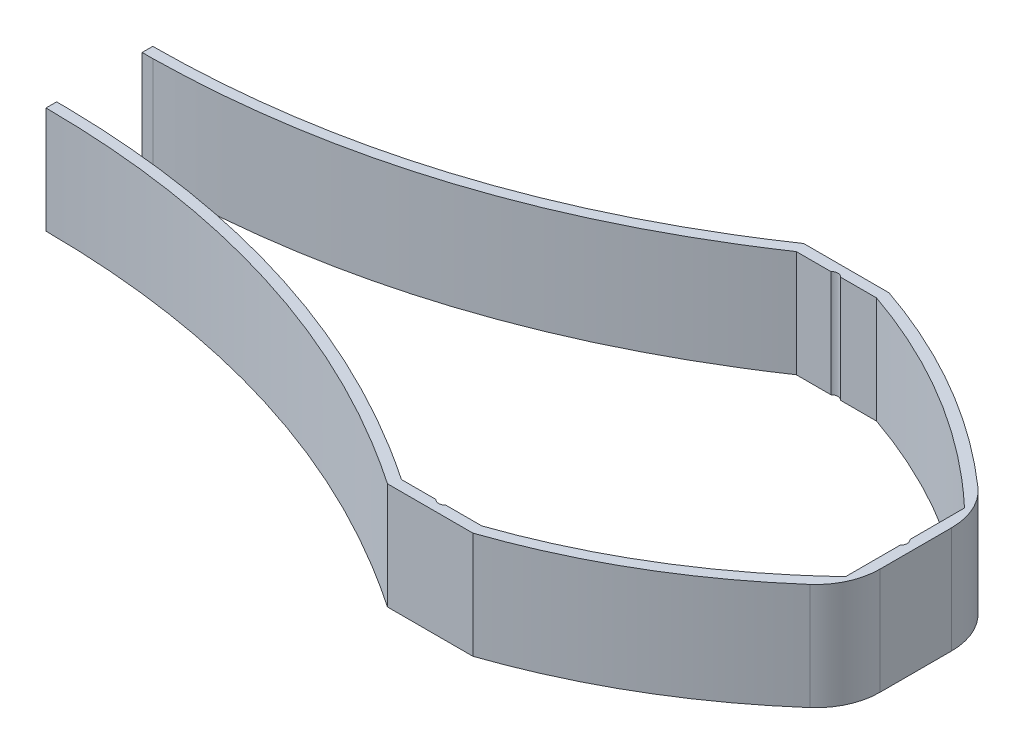
from build123d import *
from build123d.topology import SkipClean

# Parameters (mm, degrees)
BOSS_EXTRUDE1_DEPTH    = 12.5
SKETCH2_R              = 1.5
CUT_EXTRUDE1_DEPTH     = 86.009190843
FILLET1_R              = 15
FILLET1_OF_MIRROR2_R   = 15
BOSS_EXTRUDE2_DEPTH    = 12.5
CUT_EXTRUDE2_START     = -25
CUT_EXTRUDE2_OUTLINE_R = 1.5
CUT_EXTRUDE2_DEPTH     = 25


# Read off the part's stored shape, not the designer's step: Cut-Extrude2
with BuildPart() as part:
    # Sketch1 → Boss-Extrude1 (new, symmetric)
    with BuildSketch(Plane(origin=(0, 0, 0), x_dir=(1, 0, 0), z_dir=(0, 1, 0))):
        with BuildLine():
            Line((0, 0), (0, 48.75))
            Line((0, 48.75), (10, 48.75))
            add(Edge.make_bspline(
                [(65, 15), (40.796135722, 38.189445994), (10, 48.75)],
                knots=[0, 0, 0, 1, 1, 1], degree=2))
            Line((65, 15), (65, 0))
            Line((65, 0), (0, 0))
        make_face()
        with BuildLine():
            Line((62.5, 2.5), (62.5, 13.928132153))
            add(Edge.make_bspline(
                [(9.581468488, 46.25), (12.035367086, 45.400811044), (16.909722193, 43.568104851), (26.364255376, 39.421278407), (35.440243368, 34.530590442), (44.127573037, 28.89943456), (50.454869411, 24.301224925), (56.581064624, 19.33978557), (60.564095922, 15.758569119), (62.5, 13.928132153)],
                knots=[0.016127459, 0.016127459, 0.016127459, 0.016127459, 0.138301121, 0.260474783, 0.504822107, 0.626995769, 0.749169431, 0.871343093, 0.993516755, 0.993516755, 0.993516755, 0.993516755], degree=3))
            Line((9.581468488, 46.25), (2.5, 46.25))
            Line((2.5, 46.25), (2.5, 2.5))
            Line((2.5, 2.5), (62.5, 2.5))
        make_face(mode=Mode.SUBTRACT)
    boss_extrude1 = extrude(amount=BOSS_EXTRUDE1_DEPTH, both=True)

    # Sketch2 → Cut-Extrude1 (cut, through all)
    with BuildSketch(Plane(origin=(0, 12.5, 0), x_dir=(1, 0, 0), z_dir=(0, 1, 0))):
        with Locations((0, 45.25)):
            Circle(SKETCH2_R)
        with Locations((61.5, 0)):
            Circle(SKETCH2_R)
    cut_extrude1 = extrude(amount=-CUT_EXTRUDE1_DEPTH, mode=Mode.SUBTRACT)

    # Fillet1
    fillet1_edges = [part.edges().sort_by_distance(p)[0] for p in [
        (65, -6.25, -15),
    ]]
    fillet(fillet1_edges, radius=FILLET1_R)

    # Mirror2: Boss-Extrude1, Cut-Extrude1 across plane
    add(boss_extrude1.mirror(Plane.XY))
    add(cut_extrude1.mirror(Plane.XY), mode=Mode.SUBTRACT)

    # Fillet1 of Mirror2
    fillet1_of_mirror2_edges = [part.edges().sort_by_distance(p)[0] for p in [
        (65, -6.25, 15),
    ]]
    fillet(fillet1_of_mirror2_edges, radius=FILLET1_OF_MIRROR2_R)

    # Sketch3 → Boss-Extrude2 (add, symmetric)
    with BuildSketch(Plane(origin=(0, 0, 0), x_dir=(1, 0, 0), z_dir=(0, 1, 0))):
        with BuildLine():
            Line((-46.25, 0), (0, 0))
            Line((0, 0), (0, 43.75))
            ThreePointArc((0, 43.75), (-1.5, 45.25), (0, 46.75))
            Line((0, 46.75), (0, 48.75))
            Line((0, 48.75), (-10, 48.75))
            add(Edge.make_bspline(
                [(-71.25, 20), (-39.034297028, 28.989339219), (-10, 48.75)],
                knots=[0.450666758, 0.450666758, 0.450666758, 1, 1, 1], degree=2))
            Line((-71.25, 20), (-71.25, 17.405763111))
            add(Edge.make_bspline(
                [(-71.25, 17.405763111), (-68.804085612, 18.079154301), (-61.570750949, 20.218146319), (-49.736452339, 24.45212278), (-35.894853487, 30.589540657), (-24.624252983, 36.598455806), (-15.780844456, 41.931798862), (-11.393439504, 44.789554807), (-9.232239158, 46.25)],
                knots=[0.44501272, 0.44501272, 0.44501272, 0.44501272, 0.506735122, 0.628557545, 0.750379969, 0.872202392, 0.933113604, 0.994024816, 0.994024816, 0.994024816, 0.994024816], degree=3))
            Line((-9.232239158, 46.25), (-2.449489743, 46.25))
            Line((-2.449489743, 46.25), (-2.5, 43.75))
            Line((-2.5, 43.75), (-2.5, 2.5))
            Line((-2.5, 2.5), (-46.25, 2.5))
            Line((-46.25, 2.5), (-56.25, 2.5))
            Line((-56.25, 2.5), (-71.25, 2.5))
            Line((-71.25, 2.5), (-71.25, 0))
            Line((-71.25, 0), (-57.75, 0))
            ThreePointArc((-57.75, 0), (-56.25, 1.5), (-54.75, 0))
            Line((-54.75, 0), (-46.25, 0))
        make_face()
        with BuildLine():
            Line((-84.75, 0), (-71.25, 0))
            Line((-71.25, 0), (-71.25, 2.5))
            Line((-71.25, 2.5), (-86.25, 2.5))
            Line((-86.25, 2.5), (-116.25, 2.5))
            Line((-116.25, 2.5), (-123.75, 2.5))
            Line((-123.75, 2.5), (-123.75, 10.024600989))
            add(Edge.make_bspline(
                [(-123.75, 10.024600989), (-121.166874207, 10.064334515), (-115.985751374, 10.233715146), (-105.768370772, 10.929199512), (-93.175113482, 12.469190718), (-80.879501921, 14.897054004), (-73.631623298, 16.750072071), (-71.25, 17.405763111)],
                knots=[0.019445427, 0.019445427, 0.019445427, 0.019445427, 0.080356639, 0.141267851, 0.263090274, 0.384912698, 0.44501272, 0.44501272, 0.44501272, 0.44501272], degree=3))
            Line((-71.25, 17.405763111), (-71.25, 20))
            add(Edge.make_bspline(
                [(-126.25, 12.5), (-97.67939718, 12.625248103), (-71.25, 20)],
                knots=[0, 0, 0, 0.450666758, 0.450666758, 0.450666758], degree=2))
            Line((-126.25, 12.5), (-126.25, 0))
            Line((-126.25, 0), (-117.75, 0))
            ThreePointArc((-117.75, 0), (-116.25, 1.5), (-114.75, 0))
            Line((-114.75, 0), (-87.75, 0))
            ThreePointArc((-87.75, 0), (-86.25, 1.5), (-84.75, 0))
        make_face()
    boss_extrude2 = extrude(amount=BOSS_EXTRUDE2_DEPTH, both=True)

    # Mirror3: Boss-Extrude2 across plane
    add(boss_extrude2.mirror(Plane.XY))

    # Cut-Extrude2 outline → Cut-Extrude2 (cut)
    with SkipClean():  # the faces are left unmerged after this step: merging them gives an invalid solid
        with BuildSketch(Plane(origin=(0, 12.5, 0), x_dir=(1, 0, 0), z_dir=(0, 1, 0)).offset(CUT_EXTRUDE2_START)):
            with BuildLine():
                Line((2.5, -2.5), (62.5, -2.5))
                Line((62.5, -2.5), (62.5, -1.118033989))
                ThreePointArc((62.5, -1.118033989), (60, 0), (62.5, 1.118033989))
                Line((62.5, 1.118033989), (62.5, 2.5))
                Line((62.5, 2.5), (2.5, 2.5))
                Line((2.5, 2.5), (2.5, 46.25))
                Line((2.5, 46.25), (1.118033989, 46.25))
                ThreePointArc((1.118033989, 46.25), (0, 43.75), (-1.118033989, 46.25))
                Line((-1.118033989, 46.25), (-2.449489743, 46.25))
                Line((-2.449489743, 46.25), (-2.5, 43.75))
                Line((-2.5, 43.75), (-2.5, 2.5))
                Line((-2.5, 2.5), (-123.75, 2.5))
                Line((-123.75, 2.5), (-123.75, 10.024600989))
                Line((-123.75, 10.024600989), (-126.25, 10.024600989))
                Line((-126.25, 10.024600989), (-126.25, -10.024600989))
                Line((-126.25, -10.024600989), (-123.75, -10.024600989))
                Line((-123.75, -10.024600989), (-123.75, -2.5))
                Line((-123.75, -2.5), (-2.5, -2.5))
                Line((-2.5, -2.5), (-2.5, -43.75))
                Line((-2.5, -43.75), (-2.449489743, -46.25))
                Line((-2.449489743, -46.25), (-1.118033989, -46.25))
                ThreePointArc((-1.118033989, -46.25), (0, -43.75), (1.118033989, -46.25))
                Line((1.118033989, -46.25), (2.5, -46.25))
                Line((2.5, -46.25), (2.5, -2.5))
            make_face()
            with Locations((-116.25, 0)):
                Circle(CUT_EXTRUDE2_OUTLINE_R, mode=Mode.SUBTRACT)
            with Locations((-86.25, 0)):
                Circle(CUT_EXTRUDE2_OUTLINE_R, mode=Mode.SUBTRACT)
            with Locations((-56.25, 0)):
                Circle(CUT_EXTRUDE2_OUTLINE_R, mode=Mode.SUBTRACT)
        extrude(amount=CUT_EXTRUDE2_DEPTH, mode=Mode.SUBTRACT)


solid = part.part
